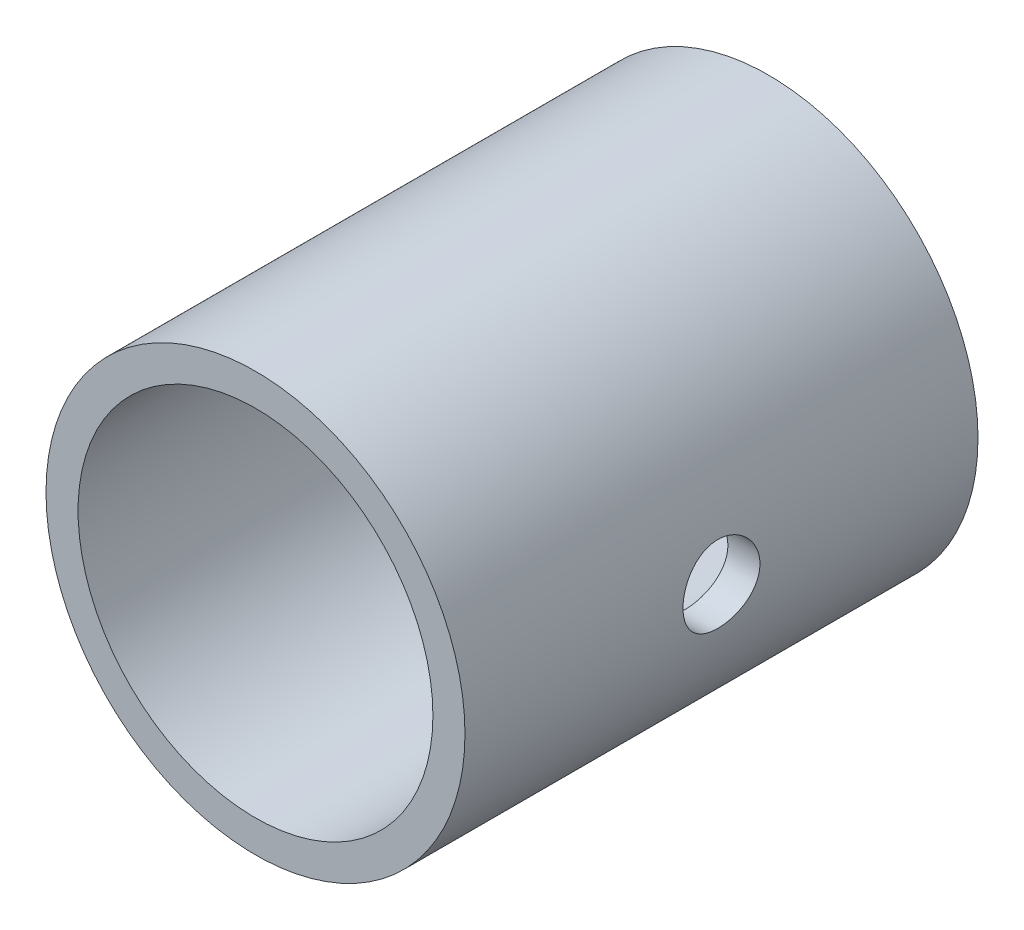
from build123d import *

# Parameters (mm, degrees)
SKETCH1_R               = 4.9
BOSS_EXTRUDE1_DEPTH     = 12
SKETCH2_R               = 4.15
CUT_EXTRUDE1_DEPTH      = 15
CUT_EXTRUDE2_DEPTH      = 14.85712813
CUT_EXTRUDE2_DEPTH_BACK = 14.85712813
SKETCH3_R               = 0.9


with BuildPart() as part:
    # Sketch1 → Boss-Extrude1 (new body)
    with BuildSketch(Plane.XY):
        Circle(SKETCH1_R)
    extrude(amount=BOSS_EXTRUDE1_DEPTH)

    # Sketch2 → Cut-Extrude1 (cut)
    with BuildSketch(Plane.XY.offset(12)):
        Circle(SKETCH2_R)
    extrude(amount=-CUT_EXTRUDE1_DEPTH, mode=Mode.SUBTRACT)

    # Sketch3 → Cut-Extrude2 (cut, two sides: drawn at the far end of the back side and taken through both)
    with BuildSketch(Plane(origin=(0, 0, 0), x_dir=(0, 0, -1), z_dir=(1, 0, 0)).offset(-CUT_EXTRUDE2_DEPTH_BACK)):
        with Locations((-6, 0)):
            Circle(SKETCH3_R)
    extrude(amount=CUT_EXTRUDE2_DEPTH + CUT_EXTRUDE2_DEPTH_BACK, mode=Mode.SUBTRACT)


solid = part.part
